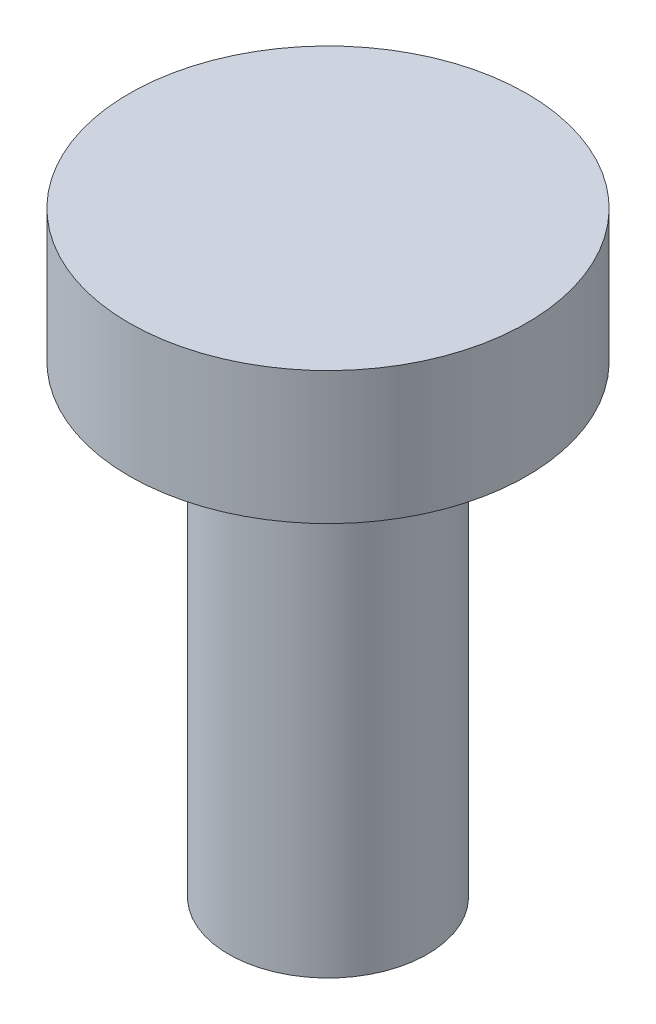
from build123d import *


with BuildPart() as part:
    # Sketch1 → Revolve1 (revolve)
    with BuildSketch(Plane.XY):
        Polygon((0, 0), (1.5, 0), (1.5, 7), (3, 7), (3, 9), (0, 9), align=None)
    revolve(axis=Axis((0, 7, 0), (0, 1, 0)))


solid = part.part
